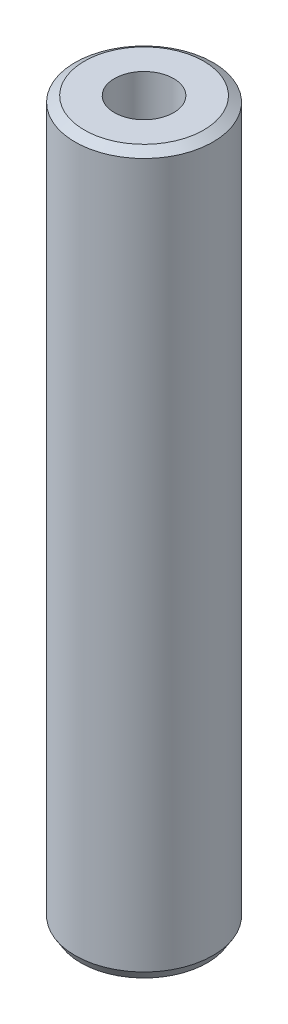
from build123d import *
from OCP.BRepFilletAPI import BRepFilletAPI_MakeChamfer

# Parameters (mm, degrees)
SKETCH1_R           = 57.5
BOSS_EXTRUDE1_DEPTH = 600
SKETCH2_R           = 24.680388079
CUT_EXTRUDE1_DEPTH  = 606.485342515
CHAMFER1_SIZE       = 4.78917583
CHAMFER1_SIZE2      = 7.724898312


with BuildPart() as part:
    # Sketch1 → Boss-Extrude1 (new body)
    with BuildSketch(Plane(origin=(0, 0, 0), x_dir=(1, 0, 0), z_dir=(0, 1, 0))):
        Circle(SKETCH1_R)
    extrude(amount=BOSS_EXTRUDE1_DEPTH)

    # Sketch2 → Cut-Extrude1 (cut, through all)
    with BuildSketch(Plane(origin=(0, 0, 0), x_dir=(1, 0, 0), z_dir=(0, 1, 0))):
        Circle(SKETCH2_R)
    extrude(amount=CUT_EXTRUDE1_DEPTH, mode=Mode.SUBTRACT)

    # Chamfer1: one chamfer whose edges measure the first distance from different faces: ONE call of the kernel's chamfer builder (chamfer() names one face for all edges)
    chamfer1_edges_1 = [part.edges().sort_by_distance(p)[0] for p in [
        (-57.5, 600, 0),
    ]]
    chamfer1_side_1 = [part.faces().sort_by_distance(p)[0] for p in [
        (-57.5, 300, 0),
    ]]
    chamfer1_edges_2 = [part.edges().sort_by_distance(p)[0] for p in [
        (-57.5, 0, 0),
    ]]
    chamfer1_side_2 = [part.faces().sort_by_distance(p)[0] for p in [
        (-55.873654403, 0, 0),
    ]]
    chamfer1 = BRepFilletAPI_MakeChamfer(part.part.solid().wrapped)
    for e in chamfer1_edges_1:
        chamfer1.Add(CHAMFER1_SIZE, CHAMFER1_SIZE2, e.wrapped, chamfer1_side_1[0].wrapped)  # the first distance lies on this face
    for e in chamfer1_edges_2:
        chamfer1.Add(CHAMFER1_SIZE, CHAMFER1_SIZE2, e.wrapped, chamfer1_side_2[0].wrapped)  # the first distance lies on this face
    add(Compound.cast(chamfer1.Shape()), mode=Mode.REPLACE)


solid = part.part
